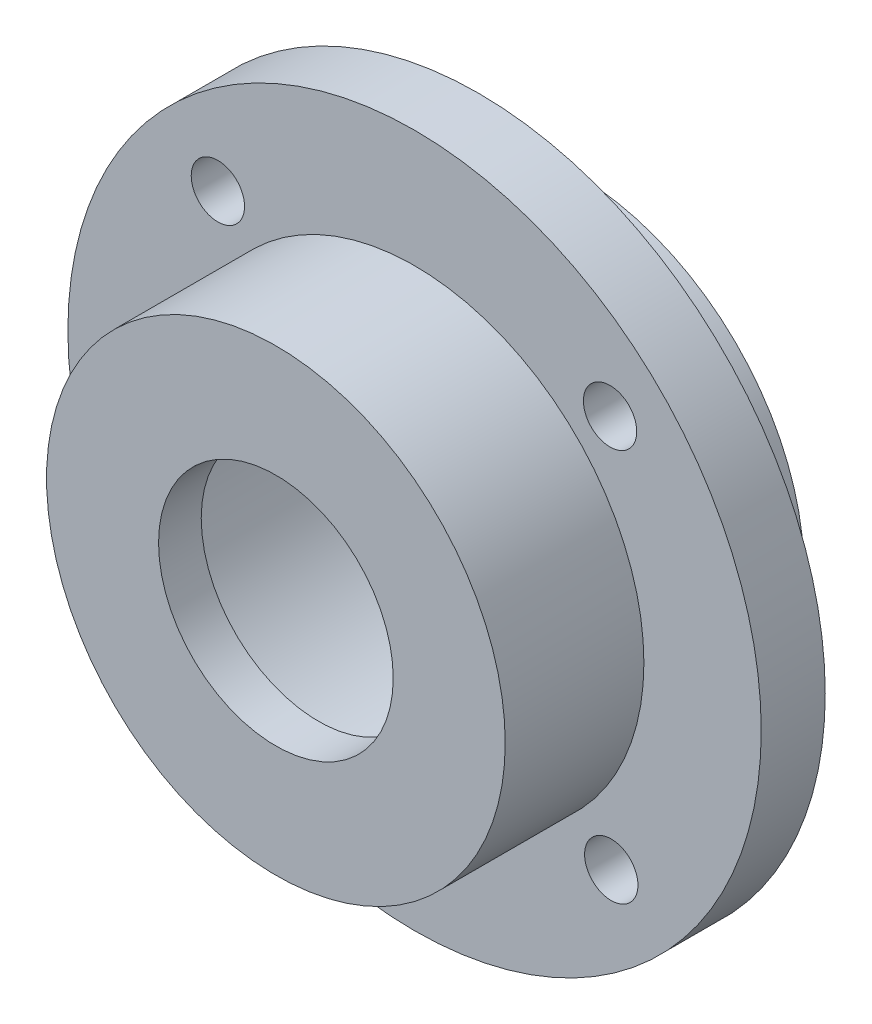
from build123d import *

# Parameters (mm, degrees)
SKETCH_1_R          = 32.5
SKETCH_1_R_2        = 17.5
SKETCH_1_R_3        = 2.5
EXTRUDE_1_DEPTH     = 24
SKETCH_2_R          = 35
SKETCH_2_R_2        = 21.5
CUT_EXTRUDE_2_DEPTH = 9
CUT_EXTRUDE_START   = -9
SKETCH_3_R          = 35
SKETCH_3_R_2        = 21.5
CUT_EXTRUDE_3_DEPTH = 9
EXTRUDE_START       = 4
SKETCH_4_R          = 21.5
SKETCH_4_R_2        = 11
EXTRUDE_4_DEPTH     = 4


with BuildPart() as part:
    # Эскиз1 → Вытянуть1 (new body)
    with BuildSketch(Plane.XY):
        Circle(SKETCH_1_R)
        Circle(SKETCH_1_R_2, mode=Mode.SUBTRACT)
        with Locations((-18.438809137, 18.327731563)):
            Circle(SKETCH_1_R_3, mode=Mode.SUBTRACT)
        with Locations((18.327731563, 18.438809137)):
            Circle(SKETCH_1_R_3, mode=Mode.SUBTRACT)
        with Locations((18.438809137, -18.327731563)):
            Circle(SKETCH_1_R_3, mode=Mode.SUBTRACT)
        with Locations((-18.327731563, -18.438809137)):
            Circle(SKETCH_1_R_3, mode=Mode.SUBTRACT)
    extrude(amount=EXTRUDE_1_DEPTH)

    # Эскиз2 → Вытянуть2 (cut)
    with BuildSketch(Plane.XY.offset(24)):
        Circle(SKETCH_2_R)
        Circle(SKETCH_2_R_2, mode=Mode.SUBTRACT)
    extrude(amount=-CUT_EXTRUDE_2_DEPTH, mode=Mode.SUBTRACT)

    # Эскиз3 → Вытянуть3 (cut)
    with BuildSketch(Plane(origin=(0, 0, 0), x_dir=(-1, 0, 0), z_dir=(0, 0, -1)).offset(CUT_EXTRUDE_START)):
        Circle(SKETCH_3_R)
        Circle(SKETCH_3_R_2, mode=Mode.SUBTRACT)
    extrude(amount=CUT_EXTRUDE_3_DEPTH, mode=Mode.SUBTRACT)

    # Эскиз4 → Вытянуть4 (add)
    with BuildSketch(Plane.XY.offset(24).offset(EXTRUDE_START)):
        Circle(SKETCH_4_R)
        Circle(SKETCH_4_R_2, mode=Mode.SUBTRACT)
    extrude(amount=-EXTRUDE_4_DEPTH)


solid = part.part
